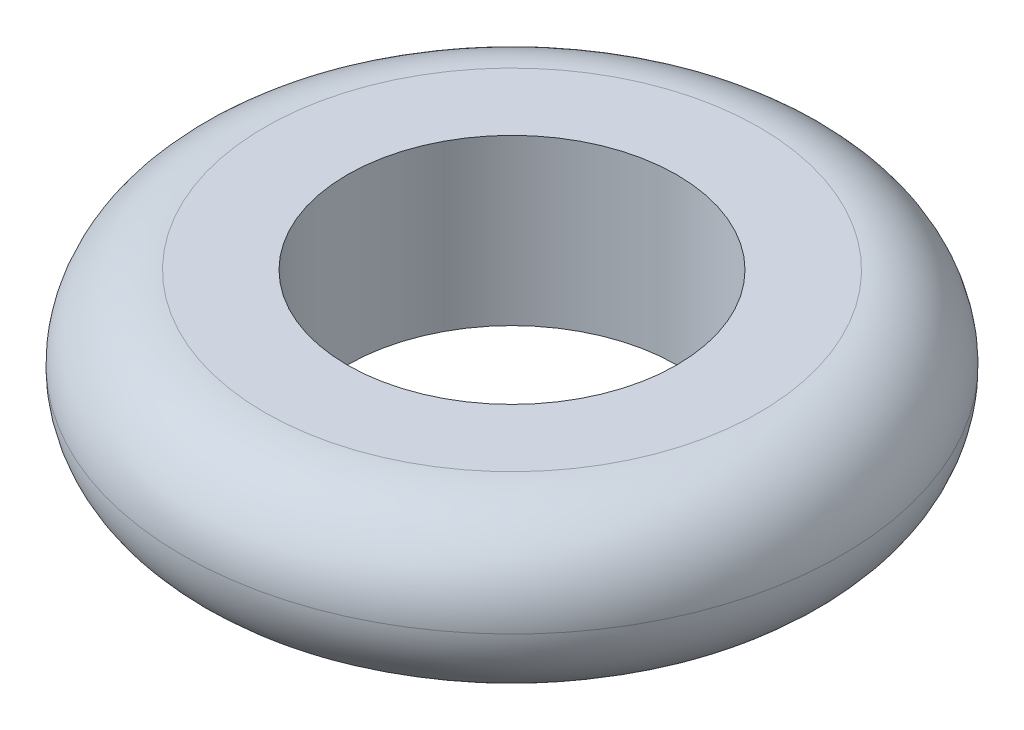
from build123d import *

# Parameters (mm, degrees)
SKETCH1_R           = 2
SKETCH1_R_2         = 1
BOSS_EXTRUDE1_DEPTH = 1
FILLET1_R           = 0.5


with BuildPart() as part:
    # Sketch1 → Boss-Extrude1 (new body)
    with BuildSketch(Plane(origin=(0, 0, 0), x_dir=(1, 0, 0), z_dir=(0, 1, 0))):
        with Locations(Location((-1.005371626, 0.37701436, 0), (0, 0, 270))):
            Circle(SKETCH1_R)
        with Locations(Location((-1.005371626, 0.37701436, 0), (0, 0, 270))):
            Circle(SKETCH1_R_2, mode=Mode.SUBTRACT)
    extrude(amount=BOSS_EXTRUDE1_DEPTH)

    # Fillet1
    fillet1_edges = [part.edges().sort_by_distance(p)[0] for p in [
        (-1.005371626, 0, -2.37701436),
        (-1.005371626, 1, -2.37701436),
    ]]
    fillet(fillet1_edges, radius=FILLET1_R - 0.0001)  # a hair under: the kernel refuses the full size


solid = part.part
